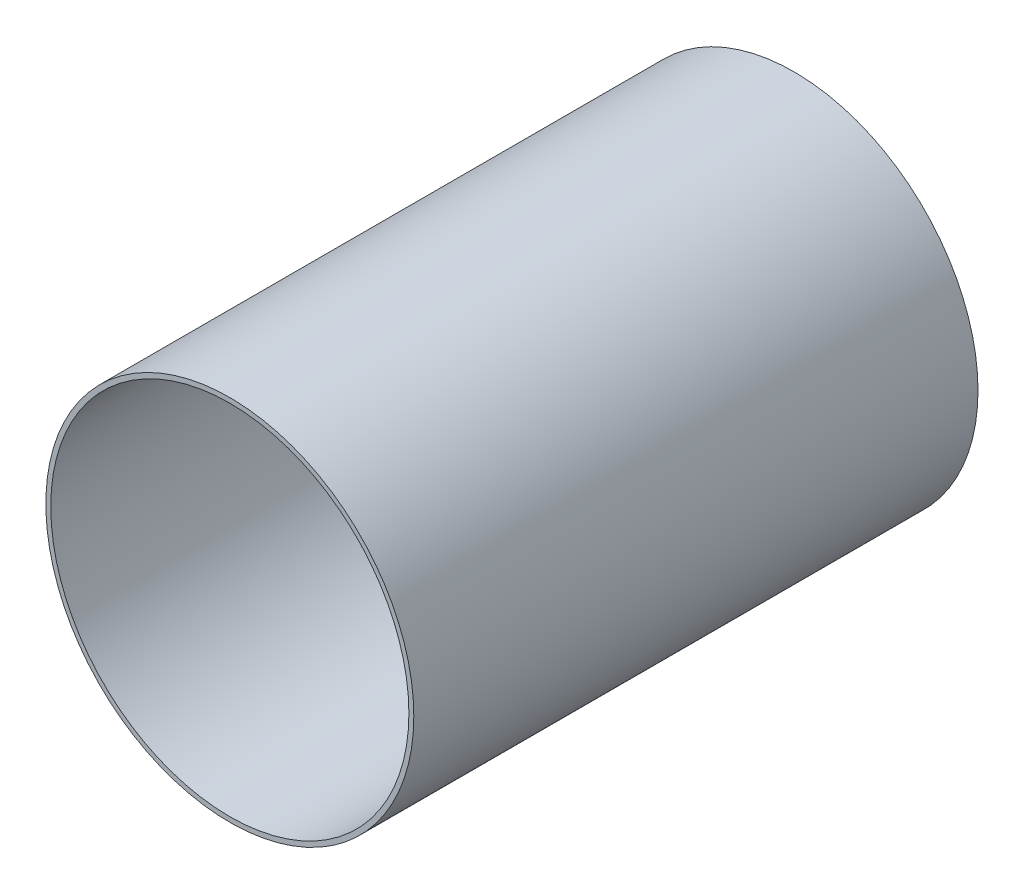
from build123d import *

# Parameters (mm, degrees)
SCHIZZO1_R                = 75
SCHIZZO1_R_2              = 73
ESTRUSIONE_SOTTILE1_DEPTH = 230


with BuildPart() as part:
    # Schizzo1 → Estrusione-Sottile1 (new body)
    with BuildSketch(Plane.XY):
        Circle(SCHIZZO1_R)
        Circle(SCHIZZO1_R_2, mode=Mode.SUBTRACT)
    extrude(amount=ESTRUSIONE_SOTTILE1_DEPTH)


solid = part.part
